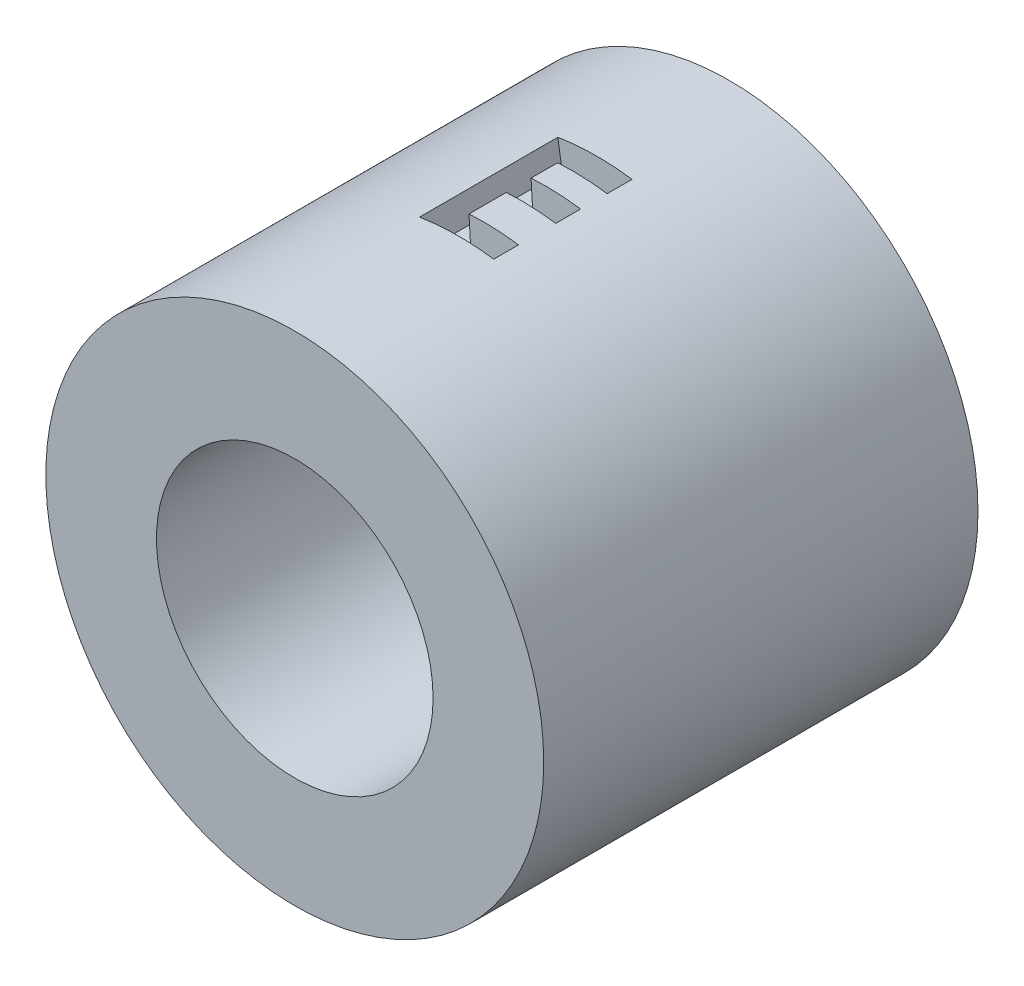
from build123d import *

# Parameters (mm, degrees)
SKETCH1_R           = 11.43
SKETCH1_R_2         = 6.35
BOSS_EXTRUDE1_DEPTH = 19.939
WRAP1_START         = 6.056366153
WRAP1_DEPTH         = 6.35
WRAP1_2_DEPTH       = 1.13974359
WRAP1_START_2       = 8.417263589
WRAP1_3_DEPTH       = 1.13974359
WRAP1_START_3       = 11.266622564
WRAP1_4_DEPTH       = 1.139743589


# Read off the part's stored shape, not the designer's step: Wrap1
with BuildPart() as part:
    # Sketch1 → Boss-Extrude1 (new body)
    with BuildSketch(Plane.XY):
        Circle(SKETCH1_R)
        Circle(SKETCH1_R_2, mode=Mode.SUBTRACT)
    extrude(amount=BOSS_EXTRUDE1_DEPTH)

    # Wrap1 outline → Wrap1 (cut)
    with BuildSketch(Plane.XY.offset(WRAP1_START)):
        with BuildLine():
            Line((-0.598615526, 10.142349799), (-0.673442467, 11.410143524))
            ThreePointArc((-0.673442467, 11.410143524), (-1.24125177, 11.362402653), (-1.80597624, 11.286423252))
            Line((-1.80597624, 11.286423252), (-1.605312214, 10.032376224))
            ThreePointArc((-1.605312214, 10.032376224), (-1.103334907, 10.099913469), (-0.598615526, 10.142349799))
        make_face()
    extrude(amount=WRAP1_DEPTH, mode=Mode.SUBTRACT)

    # Wrap1 2 outline → Wrap1 2 (cut)
    with BuildSketch(Plane.XY.offset(WRAP1_START)):
        with BuildLine():
            Line((1.422558862, 10.059916813), (1.60037872, 11.317406415))
            ThreePointArc((1.60037872, 11.317406415), (0.465781866, 11.42050556), (-0.673442467, 11.410143524))
            Line((-0.673442467, 11.410143524), (-0.598615526, 10.142349799))
            ThreePointArc((-0.598615526, 10.142349799), (0.414028326, 10.151560498), (1.422558862, 10.059916813))
        make_face()
    extrude(amount=WRAP1_2_DEPTH, mode=Mode.SUBTRACT)

    # Wrap1 3 outline → Wrap1 3 (cut)
    with BuildSketch(Plane.XY.offset(WRAP1_START_2)):
        with BuildLine():
            Line((1.422558862, 10.059916813), (1.60037872, 11.317406415))
            ThreePointArc((1.60037872, 11.317406415), (0.465781866, 11.42050556), (-0.673442467, 11.410143524))
            Line((-0.673442467, 11.410143524), (-0.598615526, 10.142349799))
            ThreePointArc((-0.598615526, 10.142349799), (0.414028326, 10.151560498), (1.422558862, 10.059916813))
        make_face()
    extrude(amount=WRAP1_3_DEPTH, mode=Mode.SUBTRACT)

    # Wrap1 4 outline → Wrap1 4 (cut)
    with BuildSketch(Plane.XY.offset(WRAP1_START_3)):
        with BuildLine():
            Line((1.422558862, 10.059916813), (1.60037872, 11.317406415))
            ThreePointArc((1.60037872, 11.317406415), (0.465781866, 11.42050556), (-0.673442467, 11.410143524))
            Line((-0.673442467, 11.410143524), (-0.598615526, 10.142349799))
            ThreePointArc((-0.598615526, 10.142349799), (0.414028326, 10.151560498), (1.422558862, 10.059916813))
        make_face()
    extrude(amount=WRAP1_4_DEPTH, mode=Mode.SUBTRACT)


solid = part.part
